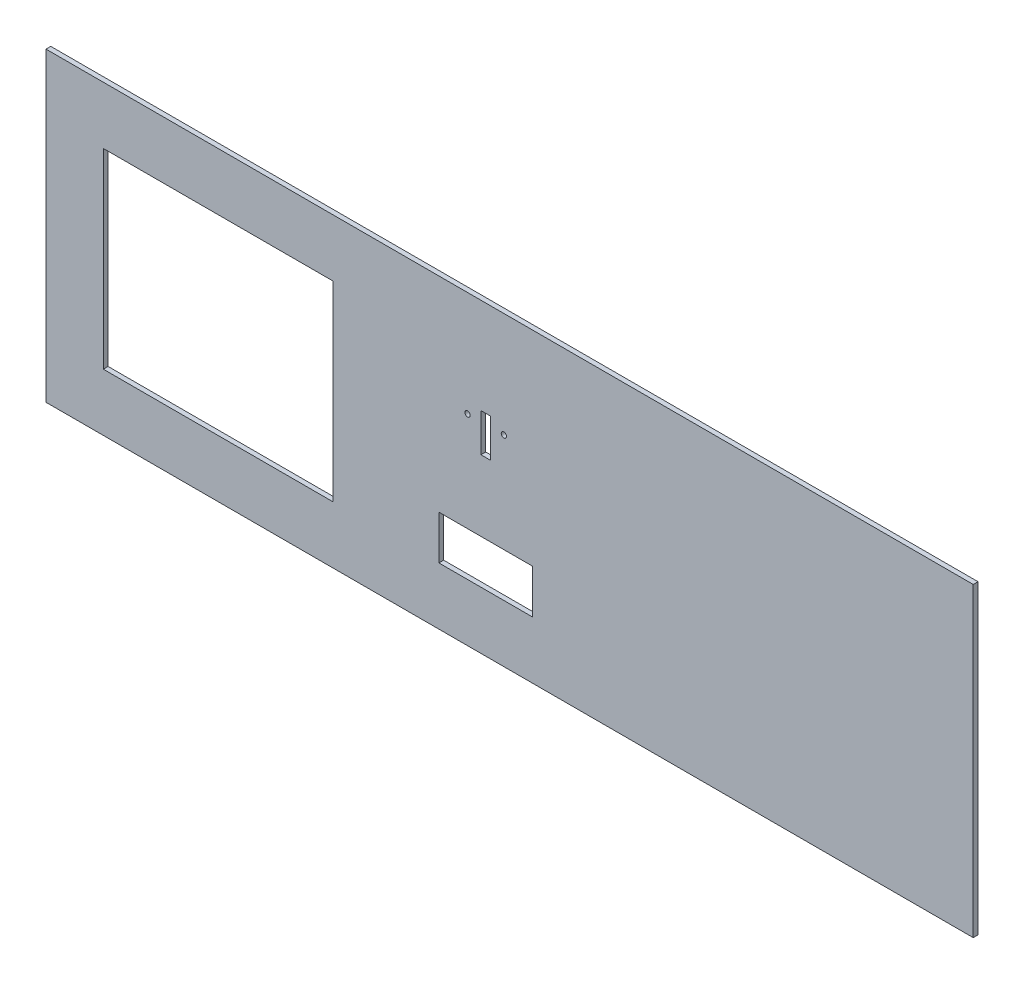
from build123d import *

# Parameters (mm, degrees)
SKETCH1_W           = 615.95
SKETCH1_H           = 203.2
BOSS_EXTRUDE1_DEPTH = 3.175
SKETCH2_W           = 152.4
SKETCH2_H           = 127
CUT_EXTRUDE1_DEPTH  = 325.316575663
SKETCH3_W           = 6.35
SKETCH3_H           = 25.4
CUT_EXTRUDE2_DEPTH  = 325.316575663
SKETCH4_R           = 1.75
CUT_EXTRUDE3_DEPTH  = 325.316575663
SKETCH5_W           = 62.23
SKETCH5_H           = 29.21
CUT_EXTRUDE4_DEPTH  = 325.316575663


with BuildPart() as part:
    # Sketch1 → Boss-Extrude1 (new body)
    with BuildSketch(Plane.XY):
        Rectangle(SKETCH1_W, SKETCH1_H)
    extrude(amount=BOSS_EXTRUDE1_DEPTH)

    # Sketch2 → Cut-Extrude1 (cut, through all)
    with BuildSketch(Plane.XY.offset(3.175)):
        with Locations((-193.675, 0)):
            Rectangle(SKETCH2_W, SKETCH2_H)
    extrude(amount=-CUT_EXTRUDE1_DEPTH, mode=Mode.SUBTRACT)

    # Sketch3 → Cut-Extrude2 (cut, through all)
    with BuildSketch(Plane.XY.offset(3.175)):
        with Locations((-15.875, 25.4)):
            Rectangle(SKETCH3_W, SKETCH3_H)
    extrude(amount=-CUT_EXTRUDE2_DEPTH, mode=Mode.SUBTRACT)

    # Sketch4 → Cut-Extrude3 (cut, through all)
    with BuildSketch(Plane.XY.offset(3.175)):
        with Locations((-3.81, 31.75)):
            Circle(SKETCH4_R)
        with Locations((-27.94, 31.75)):
            Circle(SKETCH4_R)
    extrude(amount=-CUT_EXTRUDE3_DEPTH, mode=Mode.SUBTRACT)

    # Sketch5 → Cut-Extrude4 (cut, through all)
    with BuildSketch(Plane.XY.offset(3.175)):
        with Locations((-15.875, -48.895)):
            Rectangle(SKETCH5_W, SKETCH5_H)
    extrude(amount=-CUT_EXTRUDE4_DEPTH, mode=Mode.SUBTRACT)


solid = part.part
